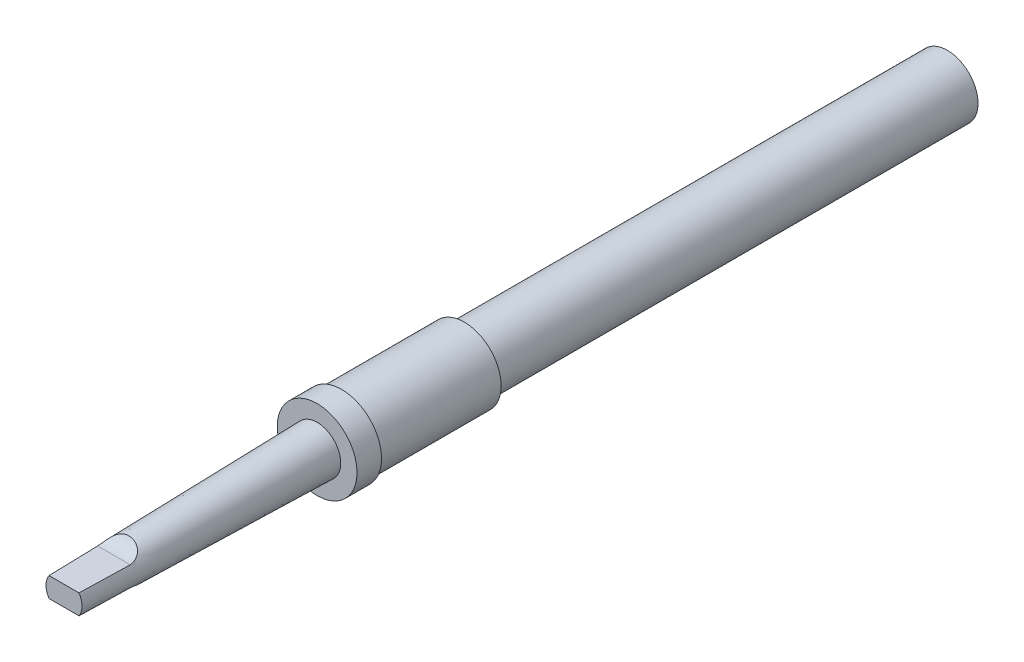
from build123d import *

# Parameters (mm, degrees)
CUT_EXTRUDE1_DEPTH      = 230.065303359
CUT_EXTRUDE1_DEPTH_BACK = 230.065303359


with BuildPart() as part:
    # Sketch3 → Revolve2 (revolve)
    with BuildSketch(Plane(origin=(0, 0, 0), x_dir=(0, 0, -1), z_dir=(1, 0, 0))):
        Polygon((-228.6, 4.661683246), (-228.6, 0), (0, 0), (0, 7.9375), (-125, 7.9375), (-125, 9.525), (-156.75, 9.525), (-156.75, 10.31875), (-163.1, 10.31875), (-163.1, 6.109884817), align=None)
    revolve(axis=Axis((0, 0, 0), (0, 0, 1)))

    # Sketch4 → Cut-Extrude1 (cut, two sides: drawn at the far end of the back side and taken through both)
    with BuildSketch(Plane(origin=(0, 0, 0), x_dir=(0, 0, -1), z_dir=(1, 0, 0)).offset(-CUT_EXTRUDE1_DEPTH_BACK)):
        with BuildLine():
            Line((-216.743897765, 6.577289591), (-261.745429365, 6.577289591))
            Line((-261.745429365, 6.577289591), (-261.745429365, 2.5781))
            Line((-261.745429365, 2.5781), (-215.657342642, 2.5781))
            ThreePointArc((-215.657342642, 2.5781), (-213.442182465, 3.342749473), (-211.818718613, 5.032716499))
            Line((-211.818718613, 5.032716499), (-216.743897765, 6.577289591))
        make_face()
        with BuildLine():
            Line((-215.657342642, -2.5781), (-261.732388213, -2.5781))
            Line((-261.732388213, -2.5781), (-261.732388213, -6.577289591))
            Line((-261.732388213, -6.577289591), (-216.743897765, -6.577289591))
            Line((-216.743897765, -6.577289591), (-211.818718613, -5.032716499))
            ThreePointArc((-211.818718613, -5.032716499), (-213.442182465, -3.342749473), (-215.657342642, -2.5781))
        make_face()
    extrude(amount=CUT_EXTRUDE1_DEPTH + CUT_EXTRUDE1_DEPTH_BACK, mode=Mode.SUBTRACT)


solid = part.part
